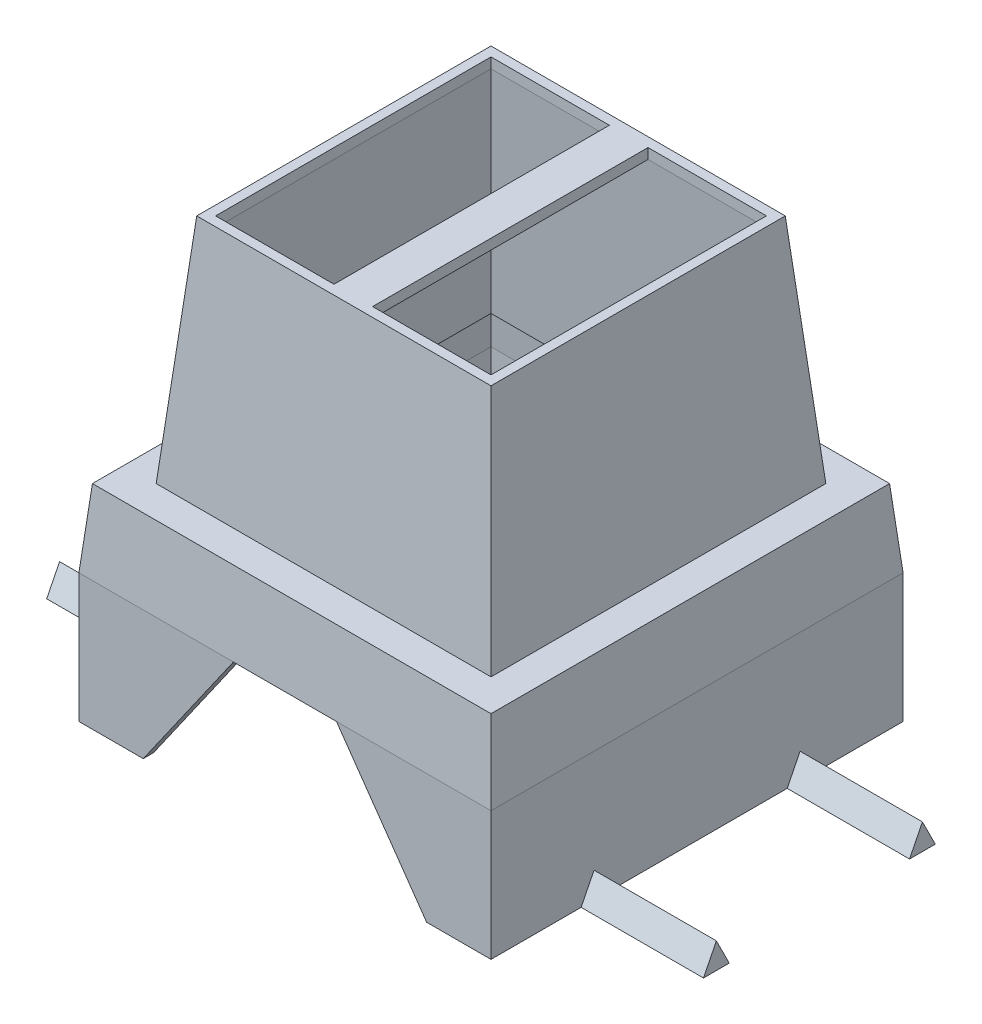
from build123d import *

# Parameters (mm, degrees)
SKETCH1_W           = 32
SKETCH1_H           = 32
BOSS_EXTRUDE1_DEPTH = 6
BOSS_EXTRUDE1_TAPER = 5
SKETCH2_W           = 26
SKETCH2_H           = 26
BOSS_EXTRUDE2_DEPTH = 18
BOSS_EXTRUDE2_TAPER = 5
SHELL1_T            = -0.8
CHAMFER1_SIZE       = 2.5
CHAMFER1_SIZE_2     = 2.750157169
SKETCH3_W           = 9.192139117
SKETCH3_H           = 21.384278234
CUT_EXTRUDE1_DEPTH  = 51.855088412
SKETCH4_W           = 32
SKETCH4_H           = 32
SKETCH4_W_2         = 30.39388826
SKETCH4_H_2         = 30.39388826
BOSS_EXTRUDE3_DEPTH = 10
BOSS_EXTRUDE4_DEPTH = 9.5
BOSS_EXTRUDE5_START = -32
BOSS_EXTRUDE5_DEPTH = 9.5
CUT_EXTRUDE2_DEPTH  = 58.638962614


with BuildPart() as part:
    # Sketch1 → Boss-Extrude1 (new body)
    with BuildSketch(Plane(origin=(0, 0, 0), x_dir=(1, 0, 0), z_dir=(0, 1, 0))):
        with Locations((-16, 16)):
            Rectangle(SKETCH1_W, SKETCH1_H)
    extrude(amount=BOSS_EXTRUDE1_DEPTH, taper=BOSS_EXTRUDE1_TAPER)

    # Sketch2 → Boss-Extrude2 (add)
    with BuildSketch(Plane(origin=(0, 6, 0), x_dir=(1, 0, 0), z_dir=(0, 1, 0))):
        with Locations((-16, 16)):
            Rectangle(SKETCH2_W, SKETCH2_H)
    extrude(amount=BOSS_EXTRUDE2_DEPTH, taper=BOSS_EXTRUDE2_TAPER)

    # Shell1
    shell1_openings = [part.faces().sort_by_distance(p)[0] for p in [
        (-16, 0, -16),
    ]]
    offset(amount=SHELL1_T, openings=shell1_openings, kind=Kind.INTERSECTION)

    # Chamfer1
    # the kernel refuses this chamfer: 2.750157169, 2.5 mm, written as the material it adds along each edge
    with BuildSketch(Plane(origin=(5.830274952, 5.2, -1.25799692), x_dir=(0, 0.030161850139926293, -0.9995450278982617), z_dir=(-1, 0, 0))) as chamfer1_piece_1_section:
        Polygon((CHAMFER1_SIZE * 0.999545027898, CHAMFER1_SIZE * 0.0301618501399), (-CHAMFER1_SIZE_2 * 0.117163164513, CHAMFER1_SIZE_2 * 0.993112678869), (0, 0), align=None)
    chamfer1_piece_1 = extrude(amount=43.660549905, mode=Mode.PRIVATE)
    chamfer1_piece_1 = split(chamfer1_piece_1, bisect_by=Plane(origin=(-1.2737044, 5.379537315, -3.779154262), z_dir=(-0.9961946980917455, -0.08715574274765792, 0)), keep=Keep.TOP, mode=Mode.PRIVATE)
    chamfer1_piece_1 = split(chamfer1_piece_1, bisect_by=Plane(origin=(-3.729971497, 5.164641789, -3.779154262), z_dir=(0.9961946980917455, 0.08715574274765821, 0)), keep=Keep.TOP, mode=Mode.PRIVATE)
    chamfer1_piece_1 = split(chamfer1_piece_1, bisect_by=Plane(origin=(-2.501837948, 5.275543614, -3.739674149), z_dir=(0, -0.08715574274765829, -0.9961946980917455)), keep=Keep.TOP, mode=Mode.PRIVATE)
    add(chamfer1_piece_1)
    with BuildSketch(Plane(origin=(5.830274952, 5.2, -1.25799692), x_dir=(0, 0.030161850139926293, -0.9995450278982617), z_dir=(-1, 0, 0))) as chamfer1_piece_2_section:
        Polygon((CHAMFER1_SIZE * 0.999545027898, CHAMFER1_SIZE * 0.0301618501399), (-CHAMFER1_SIZE_2 * 0.117163164513, CHAMFER1_SIZE_2 * 0.993112678869), (0, 0), align=None)
    chamfer1_piece_2 = extrude(amount=43.660549905, mode=Mode.PRIVATE)
    chamfer1_piece_2 = split(chamfer1_piece_2, bisect_by=Plane(origin=(-1.187972058, 4.399612159, -1.99521412), z_dir=(-0.9961946980917455, -0.08715574274765792, 0)), keep=Keep.TOP, mode=Mode.PRIVATE)
    chamfer1_piece_2 = split(chamfer1_piece_2, bisect_by=Plane(origin=(-3.644239154, 4.184716633, -1.99521412), z_dir=(0.9961946980917455, 0.08715574274765821, 0)), keep=Keep.TOP, mode=Mode.PRIVATE)
    chamfer1_piece_2 = split(chamfer1_piece_2, bisect_by=Plane(origin=(-2.416105606, 4.148173113, -3.641042011), z_dir=(0, 0.08715574274765829, 0.9961946980917455)), keep=Keep.TOP, mode=Mode.PRIVATE)
    add(chamfer1_piece_2)
    with BuildSketch(Plane(origin=(5.830274952, 5.2, -1.25799692), x_dir=(0, 0.030161850139926293, -0.9995450278982617), z_dir=(-1, 0, 0))) as chamfer1_piece_3_section:
        Polygon((CHAMFER1_SIZE * 0.999545027898, CHAMFER1_SIZE * 0.0301618501399), (-CHAMFER1_SIZE_2 * 0.117163164513, CHAMFER1_SIZE_2 * 0.993112678869), (0, 0), align=None)
    chamfer1_piece_3 = extrude(amount=43.660549905, mode=Mode.PRIVATE)
    chamfer1_piece_3 = split(chamfer1_piece_3, bisect_by=Plane(origin=(-3.747130429, 5.360769289, -1.993289961), z_dir=(-0.9961946980917455, -0.08715574274765821, 0)), keep=Keep.TOP, mode=Mode.PRIVATE)
    chamfer1_piece_3 = split(chamfer1_piece_3, bisect_by=Plane(origin=(-16, 4.144649452, -3.64073373), z_dir=(0, 0.08715574274765829, 0.9961946980917455)), keep=Keep.TOP, mode=Mode.PRIVATE)
    chamfer1_piece_3 = split(chamfer1_piece_3, bisect_by=Plane(origin=(-28.252869571, 5.360769289, -1.993289961), z_dir=(0.9961946980917455, -0.08715574274765829, 0)), keep=Keep.TOP, mode=Mode.PRIVATE)
    add(chamfer1_piece_3)
    with BuildSketch(Plane(origin=(5.830274952, 5.2, -1.25799692), x_dir=(0, 0.030161850139926293, -0.9995450278982617), z_dir=(-1, 0, 0))) as chamfer1_piece_4_section:
        Polygon((CHAMFER1_SIZE * 0.999545027898, CHAMFER1_SIZE * 0.0301618501399), (-CHAMFER1_SIZE_2 * 0.117163164513, CHAMFER1_SIZE_2 * 0.993112678869), (0, 0), align=None)
    chamfer1_piece_4 = extrude(amount=43.660549905, mode=Mode.PRIVATE)
    chamfer1_piece_4 = split(chamfer1_piece_4, bisect_by=Plane(origin=(-29.498162052, 5.275543614, -3.739674149), z_dir=(0, -0.08715574274765829, -0.9961946980917455)), keep=Keep.TOP, mode=Mode.PRIVATE)
    chamfer1_piece_4 = split(chamfer1_piece_4, bisect_by=Plane(origin=(-28.270028503, 5.164641789, -3.779154262), z_dir=(-0.9961946980917455, 0.08715574274765829, 0)), keep=Keep.TOP, mode=Mode.PRIVATE)
    chamfer1_piece_4 = split(chamfer1_piece_4, bisect_by=Plane(origin=(-30.7262956, 5.379537315, -3.779154262), z_dir=(0.9961946980917455, -0.08715574274765851, 0)), keep=Keep.TOP, mode=Mode.PRIVATE)
    add(chamfer1_piece_4)
    with BuildSketch(Plane(origin=(5.830274952, 5.2, -1.25799692), x_dir=(0, 0.030161850139926293, -0.9995450278982617), z_dir=(-1, 0, 0))) as chamfer1_piece_5_section:
        Polygon((CHAMFER1_SIZE * 0.999545027898, CHAMFER1_SIZE * 0.0301618501399), (-CHAMFER1_SIZE_2 * 0.117163164513, CHAMFER1_SIZE_2 * 0.993112678869), (0, 0), align=None)
    chamfer1_piece_5 = extrude(amount=43.660549905, mode=Mode.PRIVATE)
    chamfer1_piece_5 = split(chamfer1_piece_5, bisect_by=Plane(origin=(-29.583894394, 4.148173113, -3.641042011), z_dir=(0, 0.08715574274765829, 0.9961946980917455)), keep=Keep.TOP, mode=Mode.PRIVATE)
    chamfer1_piece_5 = split(chamfer1_piece_5, bisect_by=Plane(origin=(-28.355760846, 4.184716633, -1.99521412), z_dir=(-0.9961946980917455, 0.08715574274765829, 0)), keep=Keep.TOP, mode=Mode.PRIVATE)
    chamfer1_piece_5 = split(chamfer1_piece_5, bisect_by=Plane(origin=(-30.812027942, 4.399612159, -1.99521412), z_dir=(0.9961946980917455, -0.08715574274765851, 0)), keep=Keep.TOP, mode=Mode.PRIVATE)
    add(chamfer1_piece_5)
    with BuildSketch(Plane(origin=(-30.74200308, 5.2, 5.830274952), x_dir=(0.9995450278982617, 0.030161850139926356, 0), z_dir=(0, 0, -1))) as chamfer1_piece_6_section:
        Polygon((CHAMFER1_SIZE * 0.999545027898, CHAMFER1_SIZE * 0.0301618501399), (-CHAMFER1_SIZE_2 * 0.117163164513, CHAMFER1_SIZE_2 * 0.993112678869), (0, 0), align=None)
    chamfer1_piece_6 = extrude(amount=43.660549905, mode=Mode.PRIVATE)
    chamfer1_piece_6 = split(chamfer1_piece_6, bisect_by=Plane(origin=(-28.220845738, 5.164641789, -3.729971497), z_dir=(0, 0.08715574274765829, 0.9961946980917455)), keep=Keep.TOP, mode=Mode.PRIVATE)
    chamfer1_piece_6 = split(chamfer1_piece_6, bisect_by=Plane(origin=(-28.260325851, 5.275543614, -2.501837948), z_dir=(0.9961946980917455, -0.08715574274765829, 0)), keep=Keep.TOP, mode=Mode.PRIVATE)
    chamfer1_piece_6 = split(chamfer1_piece_6, bisect_by=Plane(origin=(-28.220845738, 5.379537315, -1.2737044), z_dir=(0, -0.08715574274765792, -0.9961946980917455)), keep=Keep.TOP, mode=Mode.PRIVATE)
    add(chamfer1_piece_6)
    with BuildSketch(Plane(origin=(-30.74200308, 5.2, 5.830274952), x_dir=(0.9995450278982617, 0.030161850139926356, 0), z_dir=(0, 0, -1))) as chamfer1_piece_7_section:
        Polygon((CHAMFER1_SIZE * 0.999545027898, CHAMFER1_SIZE * 0.0301618501399), (-CHAMFER1_SIZE_2 * 0.117163164513, CHAMFER1_SIZE_2 * 0.993112678869), (0, 0), align=None)
    chamfer1_piece_7 = extrude(amount=43.660549905, mode=Mode.PRIVATE)
    chamfer1_piece_7 = split(chamfer1_piece_7, bisect_by=Plane(origin=(-30.00478588, 4.184716633, -3.644239154), z_dir=(0, 0.08715574274765829, 0.9961946980917455)), keep=Keep.TOP, mode=Mode.PRIVATE)
    chamfer1_piece_7 = split(chamfer1_piece_7, bisect_by=Plane(origin=(-28.358957989, 4.148173113, -2.416105606), z_dir=(-0.9961946980917455, 0.08715574274765829, 0)), keep=Keep.TOP, mode=Mode.PRIVATE)
    chamfer1_piece_7 = split(chamfer1_piece_7, bisect_by=Plane(origin=(-30.00478588, 4.399612159, -1.187972058), z_dir=(0, -0.08715574274765792, -0.9961946980917455)), keep=Keep.TOP, mode=Mode.PRIVATE)
    add(chamfer1_piece_7)
    with BuildSketch(Plane(origin=(-30.74200308, 5.2, 5.830274952), x_dir=(0.9995450278982617, 0.030161850139926356, 0), z_dir=(0, 0, -1))) as chamfer1_piece_8_section:
        Polygon((CHAMFER1_SIZE * 0.999545027898, CHAMFER1_SIZE * 0.0301618501399), (-CHAMFER1_SIZE_2 * 0.117163164513, CHAMFER1_SIZE_2 * 0.993112678869), (0, 0), align=None)
    chamfer1_piece_8 = extrude(amount=43.660549905, mode=Mode.PRIVATE)
    chamfer1_piece_8 = split(chamfer1_piece_8, bisect_by=Plane(origin=(-30.006710039, 5.360769289, -28.252869571), z_dir=(0, -0.08715574274765829, 0.9961946980917455)), keep=Keep.TOP, mode=Mode.PRIVATE)
    chamfer1_piece_8 = split(chamfer1_piece_8, bisect_by=Plane(origin=(-30.006710039, 5.360769289, -3.747130429), z_dir=(0, -0.08715574274765829, -0.9961946980917455)), keep=Keep.TOP, mode=Mode.PRIVATE)
    chamfer1_piece_8 = split(chamfer1_piece_8, bisect_by=Plane(origin=(-28.35926627, 4.144649452, -16), z_dir=(-0.9961946980917455, 0.08715574274765829, 0)), keep=Keep.TOP, mode=Mode.PRIVATE)
    add(chamfer1_piece_8)
    with BuildSketch(Plane(origin=(-30.74200308, 5.2, 5.830274952), x_dir=(0.9995450278982617, 0.030161850139926356, 0), z_dir=(0, 0, -1))) as chamfer1_piece_9_section:
        Polygon((CHAMFER1_SIZE * 0.999545027898, CHAMFER1_SIZE * 0.0301618501399), (-CHAMFER1_SIZE_2 * 0.117163164513, CHAMFER1_SIZE_2 * 0.993112678869), (0, 0), align=None)
    chamfer1_piece_9 = extrude(amount=43.660549905, mode=Mode.PRIVATE)
    chamfer1_piece_9 = split(chamfer1_piece_9, bisect_by=Plane(origin=(-28.220845738, 5.379537315, -30.7262956), z_dir=(0, -0.08715574274765836, 0.9961946980917455)), keep=Keep.TOP, mode=Mode.PRIVATE)
    chamfer1_piece_9 = split(chamfer1_piece_9, bisect_by=Plane(origin=(-28.220845738, 5.164641789, -28.270028503), z_dir=(0, 0.08715574274765829, -0.9961946980917455)), keep=Keep.TOP, mode=Mode.PRIVATE)
    chamfer1_piece_9 = split(chamfer1_piece_9, bisect_by=Plane(origin=(-28.260325851, 5.275543614, -29.498162052), z_dir=(0.9961946980917455, -0.08715574274765829, 0)), keep=Keep.TOP, mode=Mode.PRIVATE)
    add(chamfer1_piece_9)
    with BuildSketch(Plane(origin=(-30.74200308, 5.2, 5.830274952), x_dir=(0.9995450278982617, 0.030161850139926356, 0), z_dir=(0, 0, -1))) as chamfer1_piece_10_section:
        Polygon((CHAMFER1_SIZE * 0.999545027898, CHAMFER1_SIZE * 0.0301618501399), (-CHAMFER1_SIZE_2 * 0.117163164513, CHAMFER1_SIZE_2 * 0.993112678869), (0, 0), align=None)
    chamfer1_piece_10 = extrude(amount=43.660549905, mode=Mode.PRIVATE)
    chamfer1_piece_10 = split(chamfer1_piece_10, bisect_by=Plane(origin=(-30.00478588, 4.399612159, -30.812027942), z_dir=(0, -0.08715574274765836, 0.9961946980917455)), keep=Keep.TOP, mode=Mode.PRIVATE)
    chamfer1_piece_10 = split(chamfer1_piece_10, bisect_by=Plane(origin=(-30.00478588, 4.184716633, -28.355760846), z_dir=(0, 0.08715574274765829, -0.9961946980917455)), keep=Keep.TOP, mode=Mode.PRIVATE)
    chamfer1_piece_10 = split(chamfer1_piece_10, bisect_by=Plane(origin=(-28.358957989, 4.148173113, -29.583894394), z_dir=(-0.9961946980917455, 0.08715574274765829, 0)), keep=Keep.TOP, mode=Mode.PRIVATE)
    add(chamfer1_piece_10)
    with BuildSketch(Plane(origin=(5.830274952, 5.2, -30.74200308), x_dir=(0, -0.9937112432628153, -0.11197305485280758), z_dir=(-1, 0, 0))) as chamfer1_piece_11_section:
        Polygon((CHAMFER1_SIZE_2 * 0.99968896676, CHAMFER1_SIZE_2 * 0.0249393220908), (-CHAMFER1_SIZE * 0.111973054853, CHAMFER1_SIZE * 0.993711243263), (0, 0), align=None)
    chamfer1_piece_11 = extrude(amount=43.660549905, mode=Mode.PRIVATE)
    chamfer1_piece_11 = split(chamfer1_piece_11, bisect_by=Plane(origin=(-1.187972058, 4.399612159, -30.00478588), z_dir=(-0.9961946980917455, -0.08715574274765792, 0)), keep=Keep.TOP, mode=Mode.PRIVATE)
    chamfer1_piece_11 = split(chamfer1_piece_11, bisect_by=Plane(origin=(-2.416105606, 4.148173113, -28.358957989), z_dir=(0, 0.08715574274765829, -0.9961946980917455)), keep=Keep.TOP, mode=Mode.PRIVATE)
    chamfer1_piece_11 = split(chamfer1_piece_11, bisect_by=Plane(origin=(-3.644239154, 4.184716633, -30.00478588), z_dir=(0.9961946980917455, 0.08715574274765821, 0)), keep=Keep.TOP, mode=Mode.PRIVATE)
    add(chamfer1_piece_11)
    with BuildSketch(Plane(origin=(5.830274952, 5.2, -30.74200308), x_dir=(0, -0.9937112432628153, -0.11197305485280758), z_dir=(-1, 0, 0))) as chamfer1_piece_12_section:
        Polygon((CHAMFER1_SIZE_2 * 0.99968896676, CHAMFER1_SIZE_2 * 0.0249393220908), (-CHAMFER1_SIZE * 0.111973054853, CHAMFER1_SIZE * 0.993711243263), (0, 0), align=None)
    chamfer1_piece_12 = extrude(amount=43.660549905, mode=Mode.PRIVATE)
    chamfer1_piece_12 = split(chamfer1_piece_12, bisect_by=Plane(origin=(-1.2737044, 5.379537315, -28.220845738), z_dir=(-0.9961946980917455, -0.08715574274765792, 0)), keep=Keep.TOP, mode=Mode.PRIVATE)
    chamfer1_piece_12 = split(chamfer1_piece_12, bisect_by=Plane(origin=(-2.501837948, 5.275543614, -28.260325851), z_dir=(0, -0.08715574274765829, 0.9961946980917455)), keep=Keep.TOP, mode=Mode.PRIVATE)
    chamfer1_piece_12 = split(chamfer1_piece_12, bisect_by=Plane(origin=(-3.729971497, 5.164641789, -28.220845738), z_dir=(0.9961946980917455, 0.08715574274765821, 0)), keep=Keep.TOP, mode=Mode.PRIVATE)
    add(chamfer1_piece_12)
    with BuildSketch(Plane(origin=(5.830274952, 5.2, -30.74200308), x_dir=(0, -0.9937112432628153, -0.11197305485280758), z_dir=(-1, 0, 0))) as chamfer1_piece_13_section:
        Polygon((CHAMFER1_SIZE_2 * 0.99968896676, CHAMFER1_SIZE_2 * 0.0249393220908), (-CHAMFER1_SIZE * 0.111973054853, CHAMFER1_SIZE * 0.993711243263), (0, 0), align=None)
    chamfer1_piece_13 = extrude(amount=43.660549905, mode=Mode.PRIVATE)
    chamfer1_piece_13 = split(chamfer1_piece_13, bisect_by=Plane(origin=(-16, 4.144649452, -28.35926627), z_dir=(0, 0.08715574274765829, -0.9961946980917455)), keep=Keep.TOP, mode=Mode.PRIVATE)
    chamfer1_piece_13 = split(chamfer1_piece_13, bisect_by=Plane(origin=(-3.747130429, 5.360769289, -30.006710039), z_dir=(-0.9961946980917455, -0.08715574274765821, 0)), keep=Keep.TOP, mode=Mode.PRIVATE)
    chamfer1_piece_13 = split(chamfer1_piece_13, bisect_by=Plane(origin=(-28.252869571, 5.360769289, -30.006710039), z_dir=(0.9961946980917455, -0.08715574274765829, 0)), keep=Keep.TOP, mode=Mode.PRIVATE)
    add(chamfer1_piece_13)
    with BuildSketch(Plane(origin=(5.830274952, 5.2, -30.74200308), x_dir=(0, -0.9937112432628153, -0.11197305485280758), z_dir=(-1, 0, 0))) as chamfer1_piece_14_section:
        Polygon((CHAMFER1_SIZE_2 * 0.99968896676, CHAMFER1_SIZE_2 * 0.0249393220908), (-CHAMFER1_SIZE * 0.111973054853, CHAMFER1_SIZE * 0.993711243263), (0, 0), align=None)
    chamfer1_piece_14 = extrude(amount=43.660549905, mode=Mode.PRIVATE)
    chamfer1_piece_14 = split(chamfer1_piece_14, bisect_by=Plane(origin=(-30.812027942, 4.399612159, -30.00478588), z_dir=(0.9961946980917455, -0.08715574274765851, 0)), keep=Keep.TOP, mode=Mode.PRIVATE)
    chamfer1_piece_14 = split(chamfer1_piece_14, bisect_by=Plane(origin=(-29.583894394, 4.148173113, -28.358957989), z_dir=(0, 0.08715574274765829, -0.9961946980917455)), keep=Keep.TOP, mode=Mode.PRIVATE)
    chamfer1_piece_14 = split(chamfer1_piece_14, bisect_by=Plane(origin=(-28.355760846, 4.184716633, -30.00478588), z_dir=(-0.9961946980917455, 0.08715574274765829, 0)), keep=Keep.TOP, mode=Mode.PRIVATE)
    add(chamfer1_piece_14)
    with BuildSketch(Plane(origin=(5.830274952, 5.2, -30.74200308), x_dir=(0, -0.9937112432628153, -0.11197305485280758), z_dir=(-1, 0, 0))) as chamfer1_piece_15_section:
        Polygon((CHAMFER1_SIZE_2 * 0.99968896676, CHAMFER1_SIZE_2 * 0.0249393220908), (-CHAMFER1_SIZE * 0.111973054853, CHAMFER1_SIZE * 0.993711243263), (0, 0), align=None)
    chamfer1_piece_15 = extrude(amount=43.660549905, mode=Mode.PRIVATE)
    chamfer1_piece_15 = split(chamfer1_piece_15, bisect_by=Plane(origin=(-30.7262956, 5.379537315, -28.220845738), z_dir=(0.9961946980917455, -0.08715574274765851, 0)), keep=Keep.TOP, mode=Mode.PRIVATE)
    chamfer1_piece_15 = split(chamfer1_piece_15, bisect_by=Plane(origin=(-29.498162052, 5.275543614, -28.260325851), z_dir=(0, -0.08715574274765829, 0.9961946980917455)), keep=Keep.TOP, mode=Mode.PRIVATE)
    chamfer1_piece_15 = split(chamfer1_piece_15, bisect_by=Plane(origin=(-28.270028503, 5.164641789, -28.220845738), z_dir=(-0.9961946980917455, 0.08715574274765829, 0)), keep=Keep.TOP, mode=Mode.PRIVATE)
    add(chamfer1_piece_15)
    with BuildSketch(Plane(origin=(-1.25799692, 5.2, 5.830274952), x_dir=(0.11197305485280797, -0.9937112432628151, 0), z_dir=(0, 0, -1))) as chamfer1_piece_16_section:
        Polygon((CHAMFER1_SIZE_2 * 0.99968896676, CHAMFER1_SIZE_2 * 0.0249393220908), (-CHAMFER1_SIZE * 0.111973054853, CHAMFER1_SIZE * 0.993711243263), (0, 0), align=None)
    chamfer1_piece_16 = extrude(amount=43.660549905, mode=Mode.PRIVATE)
    chamfer1_piece_16 = split(chamfer1_piece_16, bisect_by=Plane(origin=(-1.99521412, 4.399612159, -1.187972058), z_dir=(0, -0.08715574274765792, -0.9961946980917455)), keep=Keep.TOP, mode=Mode.PRIVATE)
    chamfer1_piece_16 = split(chamfer1_piece_16, bisect_by=Plane(origin=(-3.641042011, 4.148173113, -2.416105606), z_dir=(0.9961946980917455, 0.08715574274765821, 0)), keep=Keep.TOP, mode=Mode.PRIVATE)
    chamfer1_piece_16 = split(chamfer1_piece_16, bisect_by=Plane(origin=(-1.99521412, 4.184716633, -3.644239154), z_dir=(0, 0.08715574274765829, 0.9961946980917455)), keep=Keep.TOP, mode=Mode.PRIVATE)
    add(chamfer1_piece_16)
    with BuildSketch(Plane(origin=(-1.25799692, 5.2, 5.830274952), x_dir=(0.11197305485280797, -0.9937112432628151, 0), z_dir=(0, 0, -1))) as chamfer1_piece_17_section:
        Polygon((CHAMFER1_SIZE_2 * 0.99968896676, CHAMFER1_SIZE_2 * 0.0249393220908), (-CHAMFER1_SIZE * 0.111973054853, CHAMFER1_SIZE * 0.993711243263), (0, 0), align=None)
    chamfer1_piece_17 = extrude(amount=43.660549905, mode=Mode.PRIVATE)
    chamfer1_piece_17 = split(chamfer1_piece_17, bisect_by=Plane(origin=(-3.779154262, 5.379537315, -1.2737044), z_dir=(0, -0.08715574274765792, -0.9961946980917455)), keep=Keep.TOP, mode=Mode.PRIVATE)
    chamfer1_piece_17 = split(chamfer1_piece_17, bisect_by=Plane(origin=(-3.739674149, 5.275543614, -2.501837948), z_dir=(-0.9961946980917455, -0.08715574274765821, 0)), keep=Keep.TOP, mode=Mode.PRIVATE)
    chamfer1_piece_17 = split(chamfer1_piece_17, bisect_by=Plane(origin=(-3.779154262, 5.164641789, -3.729971497), z_dir=(0, 0.08715574274765829, 0.9961946980917455)), keep=Keep.TOP, mode=Mode.PRIVATE)
    add(chamfer1_piece_17)
    with BuildSketch(Plane(origin=(-1.25799692, 5.2, 5.830274952), x_dir=(0.11197305485280797, -0.9937112432628151, 0), z_dir=(0, 0, -1))) as chamfer1_piece_18_section:
        Polygon((CHAMFER1_SIZE_2 * 0.99968896676, CHAMFER1_SIZE_2 * 0.0249393220908), (-CHAMFER1_SIZE * 0.111973054853, CHAMFER1_SIZE * 0.993711243263), (0, 0), align=None)
    chamfer1_piece_18 = extrude(amount=43.660549905, mode=Mode.PRIVATE)
    chamfer1_piece_18 = split(chamfer1_piece_18, bisect_by=Plane(origin=(-1.993289961, 5.360769289, -28.252869571), z_dir=(0, -0.08715574274765829, 0.9961946980917455)), keep=Keep.TOP, mode=Mode.PRIVATE)
    chamfer1_piece_18 = split(chamfer1_piece_18, bisect_by=Plane(origin=(-3.64073373, 4.144649452, -16), z_dir=(0.9961946980917455, 0.08715574274765821, 0)), keep=Keep.TOP, mode=Mode.PRIVATE)
    chamfer1_piece_18 = split(chamfer1_piece_18, bisect_by=Plane(origin=(-1.993289961, 5.360769289, -3.747130429), z_dir=(0, -0.08715574274765829, -0.9961946980917455)), keep=Keep.TOP, mode=Mode.PRIVATE)
    add(chamfer1_piece_18)
    with BuildSketch(Plane(origin=(-1.25799692, 5.2, 5.830274952), x_dir=(0.11197305485280797, -0.9937112432628151, 0), z_dir=(0, 0, -1))) as chamfer1_piece_19_section:
        Polygon((CHAMFER1_SIZE_2 * 0.99968896676, CHAMFER1_SIZE_2 * 0.0249393220908), (-CHAMFER1_SIZE * 0.111973054853, CHAMFER1_SIZE * 0.993711243263), (0, 0), align=None)
    chamfer1_piece_19 = extrude(amount=43.660549905, mode=Mode.PRIVATE)
    chamfer1_piece_19 = split(chamfer1_piece_19, bisect_by=Plane(origin=(-1.99521412, 4.399612159, -30.812027942), z_dir=(0, -0.08715574274765836, 0.9961946980917455)), keep=Keep.TOP, mode=Mode.PRIVATE)
    chamfer1_piece_19 = split(chamfer1_piece_19, bisect_by=Plane(origin=(-1.99521412, 4.184716633, -28.355760846), z_dir=(0, 0.08715574274765829, -0.9961946980917455)), keep=Keep.TOP, mode=Mode.PRIVATE)
    chamfer1_piece_19 = split(chamfer1_piece_19, bisect_by=Plane(origin=(-3.641042011, 4.148173113, -29.583894394), z_dir=(0.9961946980917455, 0.08715574274765821, 0)), keep=Keep.TOP, mode=Mode.PRIVATE)
    add(chamfer1_piece_19)
    with BuildSketch(Plane(origin=(-1.25799692, 5.2, 5.830274952), x_dir=(0.11197305485280797, -0.9937112432628151, 0), z_dir=(0, 0, -1))) as chamfer1_piece_20_section:
        Polygon((CHAMFER1_SIZE_2 * 0.99968896676, CHAMFER1_SIZE_2 * 0.0249393220908), (-CHAMFER1_SIZE * 0.111973054853, CHAMFER1_SIZE * 0.993711243263), (0, 0), align=None)
    chamfer1_piece_20 = extrude(amount=43.660549905, mode=Mode.PRIVATE)
    chamfer1_piece_20 = split(chamfer1_piece_20, bisect_by=Plane(origin=(-3.779154262, 5.379537315, -30.7262956), z_dir=(0, -0.08715574274765836, 0.9961946980917455)), keep=Keep.TOP, mode=Mode.PRIVATE)
    chamfer1_piece_20 = split(chamfer1_piece_20, bisect_by=Plane(origin=(-3.779154262, 5.164641789, -28.270028503), z_dir=(0, 0.08715574274765829, -0.9961946980917455)), keep=Keep.TOP, mode=Mode.PRIVATE)
    chamfer1_piece_20 = split(chamfer1_piece_20, bisect_by=Plane(origin=(-3.739674149, 5.275543614, -29.498162052), z_dir=(-0.9961946980917455, -0.08715574274765821, 0)), keep=Keep.TOP, mode=Mode.PRIVATE)
    add(chamfer1_piece_20)

    # Sketch3 → Cut-Extrude1 (cut, through all)
    with BuildSketch(Plane.XZ.offset(-23.2)):
        with Locations((-22.096069558, -16)):
            Rectangle(SKETCH3_W, SKETCH3_H)
        with Locations((-9.903930442, -16)):
            Rectangle(SKETCH3_W, SKETCH3_H)
    extrude(amount=-CUT_EXTRUDE1_DEPTH, mode=Mode.SUBTRACT)

    # Sketch4 → Boss-Extrude3 (add)
    with BuildSketch(Plane.XZ):
        with Locations((-16, -16)):
            Rectangle(SKETCH4_W, SKETCH4_H)
        with Locations((-16, -16)):
            Rectangle(SKETCH4_W_2, SKETCH4_H_2, mode=Mode.SUBTRACT)
    extrude(amount=BOSS_EXTRUDE3_DEPTH)

    # Sketch5 → Boss-Extrude4 (add)
    with BuildSketch(Plane.ZY.offset(32)):
        Polygon((-24, -8), (-25, -10), (-23, -10), align=None)
        Polygon((-8, -8), (-9, -10), (-7, -10), align=None)
    extrude(amount=BOSS_EXTRUDE4_DEPTH)

    # Sketch5<3> → Boss-Extrude5 (add)
    with BuildSketch(Plane.ZY.offset(32).offset(BOSS_EXTRUDE5_START)):
        Polygon((-8, -8), (-9, -10), (-7, -10), align=None)
        Polygon((-24, -8), (-25, -10), (-23, -10), align=None)
    extrude(amount=-BOSS_EXTRUDE5_DEPTH)

    # Sketch6 → Cut-Extrude2 (cut, through all)
    with BuildSketch(Plane(origin=(0, 0, -32), x_dir=(-1, 0, 0), z_dir=(0, 0, -1))):
        Polygon((12, 0), (4.997924618, -10), (27.002075382, -10), (20, 0), align=None)
    extrude(amount=-CUT_EXTRUDE2_DEPTH, mode=Mode.SUBTRACT)


solid = part.part
